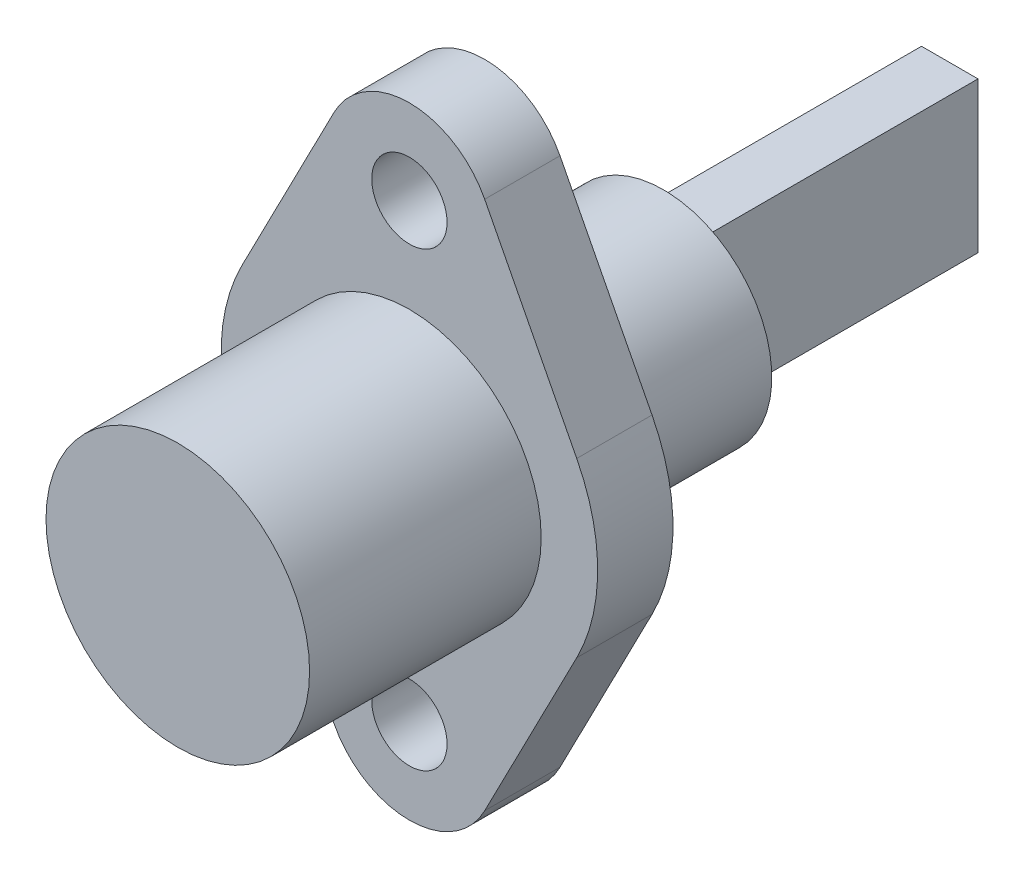
from build123d import *

# Parameters (mm, degrees)
SKETCH1_R           = 2
BOSS_EXTRUDE1_DEPTH = 4
SKETCH2_R           = 7
BOSS_EXTRUDE2_DEPTH = 12.3
SKETCH3_R           = 7.5
BOSS_EXTRUDE3_DEPTH = 0.5
SKETCH4_W           = 3
SKETCH4_H           = 8
BOSS_EXTRUDE4_DEPTH = 24.2
SKETCH5_R           = 5.75
BOSS_EXTRUDE5_DEPTH = 9


with BuildPart() as part:
    # Sketch1 → Boss-Extrude1 (new body)
    with BuildSketch(Plane.XY):
        with BuildLine():
            Line((-3.99951164, 14.062500095), (-8.887803753, 4.583333333))
            ThreePointArc((-8.887803753, 4.583333333), (-10, 0), (-8.887803753, -4.583333333))
            Line((-8.887803753, -4.583333333), (-3.999511648, -14.062500079))
            ThreePointArc((-3.999511648, -14.062500079), (-8.7e-08, -16.5), (3.999511568, -14.062500234))
            Line((3.999511568, -14.062500234), (8.887803753, -4.583333333))
            ThreePointArc((8.887803753, -4.583333333), (10, 0), (8.887803753, 4.583333333))
            Line((8.887803753, 4.583333333), (3.999511579, 14.062500214))
            ThreePointArc((3.999511579, 14.062500214), (-6.7e-08, 16.5), (-3.99951164, 14.062500095))
        make_face()
        with Locations((0, 12)):
            Circle(SKETCH1_R, mode=Mode.SUBTRACT)
        with Locations((0, -12)):
            Circle(SKETCH1_R, mode=Mode.SUBTRACT)
    extrude(amount=BOSS_EXTRUDE1_DEPTH)

    # Sketch2 → Boss-Extrude2 (add)
    with BuildSketch(Plane.XY.offset(4)):
        Circle(SKETCH2_R)
    extrude(amount=BOSS_EXTRUDE2_DEPTH)

    # Sketch3 → Boss-Extrude3 (add)
    with BuildSketch(Plane(origin=(0, 0, 0), x_dir=(-1, 0, 0), z_dir=(0, 0, -1))):
        Circle(SKETCH3_R)
    extrude(amount=BOSS_EXTRUDE3_DEPTH)

    # Sketch4 → Boss-Extrude4 (add)
    with BuildSketch(Plane(origin=(0, 0, -0.5), x_dir=(-1, 0, 0), z_dir=(0, 0, -1))):
        Rectangle(SKETCH4_W, SKETCH4_H)
    extrude(amount=BOSS_EXTRUDE4_DEPTH)

    # Sketch5 → Boss-Extrude5 (add)
    with BuildSketch(Plane(origin=(0, 0, -0.5), x_dir=(-1, 0, 0), z_dir=(0, 0, -1))):
        Circle(SKETCH5_R)
    extrude(amount=BOSS_EXTRUDE5_DEPTH)


solid = part.part
